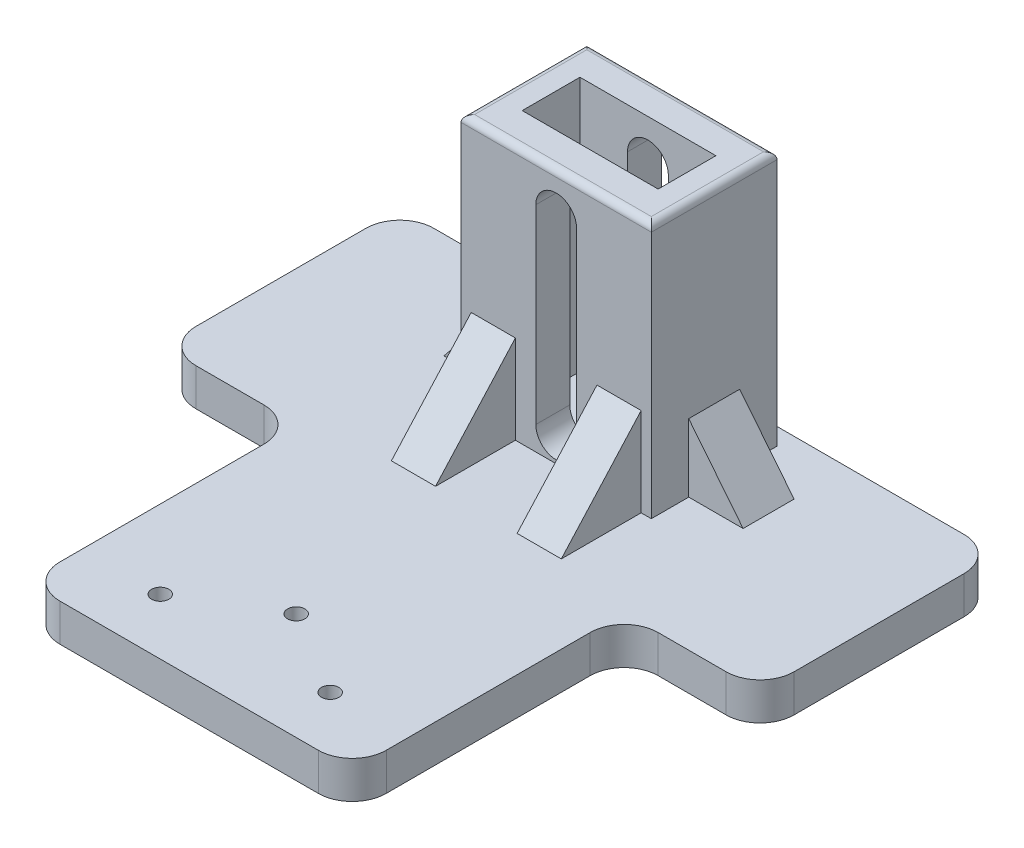
from build123d import *

# Parameters (mm, degrees)
EXTRUDE_1_DEPTH     = 6
SKETCH_2_W          = 40
SKETCH_2_H          = 17
EXTRUDE_2_DEPTH     = 80
EXTRUDE_3_DEPTH     = 7.5
EXTRUDE_4_DEPTH     = 25
CUT_EXTRUDE_1_DEPTH = 124.93663618022231
CUT_EXTRUDE_2_DEPTH = 80
FILLET_1_R          = 2
SKETCH_11_R         = 2.549999999999998
SKETCH_11_W         = 176.00000000000006
SKETCH_11_H         = 70
EXTRUDE_5_DEPTH     = 6
FILLET_2_R          = 10
EXTRUDE_6_OUTLINE_R = 2.55
EXTRUDE_6_DEPTH     = 5


# Read off the part's stored shape, not the designer's step: 凸台-拉伸6
with BuildPart() as part:
    # 草图1 → 凸台-拉伸1 (new body)
    with BuildSketch(Plane(origin=(0, 0, 0), x_dir=(1, 0, 0), z_dir=(0, 1, 0))):
        Polygon((-61.14973252328083, 43.789730909681225), (-61.149732523280825, -26.210269090318775), (34.85026747671919, -26.210269090318782), (34.85026747671917, 43.789730909681225), align=None)
    extrude(amount=EXTRUDE_1_DEPTH)

    # 草图2 → 凸台-拉伸2 (add)
    with BuildSketch(Plane(origin=(0, 6, 0), x_dir=(1, 0, 0), z_dir=(0, 1, 0))):
        Polygon((-41.14973252328083, 38.78973090968122), (14.850267476719164, 38.78973090968122), (14.850267476719166, 1.7897309096812228), (-41.149732523280825, 1.7897309096812228), align=None)
        with Locations((-13.14973252328083, 20.289730909681225)):
            Rectangle(SKETCH_2_W, SKETCH_2_H, mode=Mode.SUBTRACT)
    extrude(amount=EXTRUDE_2_DEPTH)

    # 草图5 → 凸台-拉伸3 (add, symmetric)
    with BuildSketch(Plane.XY.offset(-20.289730909681218)):
        Polygon((-61.14973252328082, 6), (-41.149732523280825, 31), (-41.14973252328082, 6), align=None)
        Polygon((14.850267476719168, 30.999999999999996), (34.850267476719196, 6), (14.85026747671917, 6), align=None)
    extrude(amount=EXTRUDE_3_DEPTH, both=True)

    # 草图8 → 凸台-拉伸4 (add, symmetric)
    with BuildSketch(Plane(origin=(-13.149732523280829, 0, -1.23e-15), x_dir=(9e-17, 0, -1), z_dir=(1, 0, 9e-17))):
        Polygon((-26.21026909031878, 6), (1.7897309096812217, 37.0606214388455), (1.7897309096812242, 6), align=None)
    extrude(amount=EXTRUDE_4_DEPTH, both=True)

    # 草图9 → 切除-拉伸1 (cut, through all)
    with BuildSketch(Plane(origin=(0, 0, -38.78973090968122), x_dir=(-1, 0, 0), z_dir=(0, 0, -1))):
        with BuildLine():
            Line((19.149732523280832, 74.00000000000001), (19.149732523280832, 18.000000000000004))
            ThreePointArc((19.149732523280832, 18.000000000000004), (13.149732523280827, 12.000000000000002), (7.149732523280827, 18.000000000000004))
            Line((7.149732523280827, 18.000000000000004), (7.149732523280827, 74.00000000000001))
            ThreePointArc((7.149732523280827, 74.00000000000001), (13.149732523280829, 80.00000000000001), (19.149732523280832, 74.00000000000001))
        make_face()
    extrude(amount=-CUT_EXTRUDE_1_DEPTH, mode=Mode.SUBTRACT)

    # 草图10 → 切除-拉伸2 (cut)
    with BuildSketch(Plane(origin=(0, 86, 0), x_dir=(1, 0, 0), z_dir=(0, 1, 0))):
        Polygon((-25.14973252328083, 1.7897309096812328), (-1.1497325232808289, 1.7897309096812328), (-1.1497325232808246, -29.118616684918184), (-25.149732523280825, -29.118616684918184), align=None)
    extrude(amount=-CUT_EXTRUDE_2_DEPTH, mode=Mode.SUBTRACT)

    # 圆角1
    fillet_1_edges = [part.edges().sort_by_distance(p)[0] for p in [
        (14.850267476719164, 86, -20.28973090968122),
        (-13.149732523280832, 86, -38.78973090968122),
        (-41.14973252328083, 86, -20.289730909681218),
        (-13.14973252328083, 86, -1.7897309096812228),
    ]]
    fillet(fillet_1_edges, radius=FILLET_1_R)

    # 草图11 → 凸台-拉伸5 (add)
    # profile 1 of 3: a face of its own
    with BuildSketch(Plane.XZ):
        Polygon((-61.14973252328083, -43.789730909681225), (34.85026747671919, -43.789730909681225), (34.850267476719196, 106.21026909031877), (-61.14973252328083, 106.21026909031877), align=None)
        with Locations(Location((-38.14973252328083, 89.71026909031877, 0), (0, 0, 270))):
            Circle(SKETCH_11_R, mode=Mode.SUBTRACT)
        with Locations(Location((11.850267476719166, 89.71026909031877, 0), (0, 0, 270))):
            Circle(SKETCH_11_R, mode=Mode.SUBTRACT)
        with Locations(Location((-13.149732523280832, 74.71026909031877, 0), (0, 0, 270))):
            Circle(SKETCH_11_R, mode=Mode.SUBTRACT)
    # profile 2 of 3: a face of its own
    with BuildSketch(Plane.XZ):
        with Locations((-13.149732523280825, -8.789730909681222)):
            Rectangle(SKETCH_11_W, SKETCH_11_H)
    # profile 3 of 3: a face of its own
    with BuildSketch(Plane.XZ):
        Polygon((12.850267476719164, -36.78973090968122), (12.850267476719166, -3.789730909681223), (-39.14973252328082, -3.789730909681223), (-39.149732523280825, -36.78973090968122), align=None)
    extrude(amount=-EXTRUDE_5_DEPTH)

    # 圆角2
    fillet_2_edges = [part.edges().sort_by_distance(p)[0] for p in [
        (-61.149732523280825, 3, 26.21026909031878),
        (-61.14973252328083, 3, 106.21026909031877),
        (34.850267476719196, 3, 106.21026909031877),
        (34.85026747671919, 3, 26.21026909031878),
        (74.8502674767192, 3, 26.210269090318782),
        (74.8502674767192, 3, -43.789730909681225),
        (-101.14973252328083, 3, -43.789730909681225),
        (-101.14973252328083, 3, 26.210269090318782),
    ]]
    fillet(fillet_2_edges, radius=FILLET_2_R)

    # 凸台-拉伸6 outline → 凸台-拉伸6 (add)
    with BuildSketch(Plane(origin=(0, 6, 0), x_dir=(1, 0, 0), z_dir=(0, 1, 0))):
        with BuildLine():
            ThreePointArc((-61.149732523, -96.21026909), (-58.220800335, -103.281336902), (-51.149732523, -106.21026909))
            Line((-51.149732523, -106.21026909), (24.850267477, -106.21026909))
            ThreePointArc((24.850267477, -106.21026909), (31.921335289, -103.281336902), (34.850267477, -96.21026909))
            Line((34.850267477, -96.21026909), (34.850267477, -36.21026909))
            ThreePointArc((34.850267477, -36.21026909), (37.779199665, -29.139201278), (44.850267477, -26.21026909))
            Line((44.850267477, -26.21026909), (64.850267477, -26.21026909))
            ThreePointArc((64.850267477, -26.21026909), (71.921335289, -23.281336902), (74.850267477, -16.21026909))
            Line((74.850267477, -16.21026909), (74.850267477, 33.78973091))
            ThreePointArc((74.850267477, 33.78973091), (71.921335289, 40.860798722), (64.850267477, 43.78973091))
            Line((64.850267477, 43.78973091), (-91.149732523, 43.78973091))
            ThreePointArc((-91.149732523, 43.78973091), (-98.220800335, 40.860798722), (-101.149732523, 33.78973091))
            Line((-101.149732523, 33.78973091), (-101.149732523, -16.21026909))
            ThreePointArc((-101.149732523, -16.21026909), (-98.220800335, -23.281336902), (-91.149732523, -26.21026909))
            Line((-91.149732523, -26.21026909), (-71.149732523, -26.21026909))
            ThreePointArc((-71.149732523, -26.21026909), (-64.078664711, -29.139201278), (-61.149732523, -36.21026909))
            Line((-61.149732523, -36.21026909), (-61.149732523, -96.21026909))
        make_face()
        with Locations((-38.149732523, -89.71026909)):
            Circle(EXTRUDE_6_OUTLINE_R, mode=Mode.SUBTRACT)
        with Locations((11.850267477, -89.71026909)):
            Circle(EXTRUDE_6_OUTLINE_R, mode=Mode.SUBTRACT)
        with Locations((-13.149732523, -74.71026909)):
            Circle(EXTRUDE_6_OUTLINE_R, mode=Mode.SUBTRACT)
    extrude(amount=EXTRUDE_6_DEPTH)


solid = part.part
